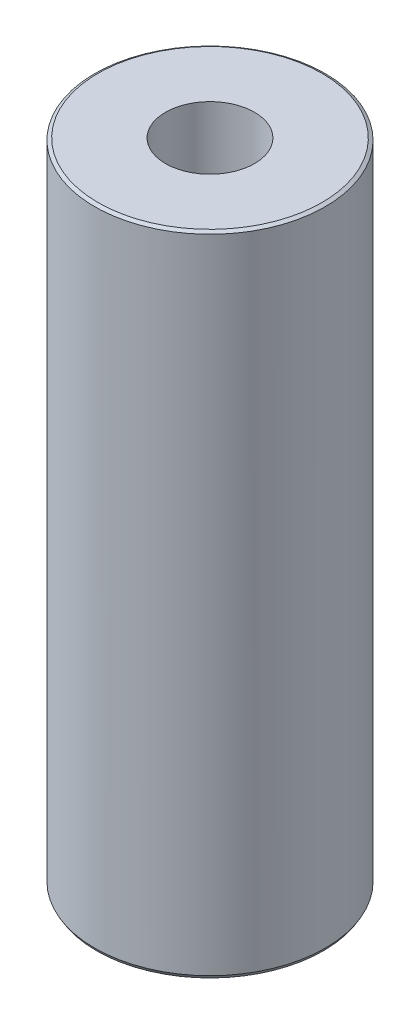
from build123d import *
from OCP.BRepFilletAPI import BRepFilletAPI_MakeChamfer

# Parameters (mm, degrees)
SKETCH1_R           = 22.5
BOSS_EXTRUDE1_DEPTH = 126.322816713
SKETCH2_R           = 8.684803949
CUT_EXTRUDE1_DEPTH  = 131.268776084
CHAMFER1_SIZE       = 0.374596634
CHAMFER1_SIZE2      = 0.648820402


with BuildPart() as part:
    # Sketch1 → Boss-Extrude1 (new body)
    with BuildSketch(Plane(origin=(0, 0, 0), x_dir=(1, 0, 0), z_dir=(0, 1, 0))):
        Circle(SKETCH1_R)
    extrude(amount=BOSS_EXTRUDE1_DEPTH)

    # Sketch2 → Cut-Extrude1 (cut, through all)
    with BuildSketch(Plane(origin=(0, 0, 0), x_dir=(1, 0, 0), z_dir=(0, 1, 0))):
        Circle(SKETCH2_R)
    extrude(amount=CUT_EXTRUDE1_DEPTH, mode=Mode.SUBTRACT)

    # Chamfer1: one chamfer whose edges measure the first distance from different faces: ONE call of the kernel's chamfer builder (chamfer() names one face for all edges)
    chamfer1_edges_1 = [part.edges().sort_by_distance(p)[0] for p in [
        (-22.5, 126.322816713, 0),
    ]]
    chamfer1_side_1 = [part.faces().sort_by_distance(p)[0] for p in [
        (-22.5, 63.161408357, 0),
    ]]
    chamfer1_edges_2 = [part.edges().sort_by_distance(p)[0] for p in [
        (-22.5, 0, 0),
    ]]
    chamfer1_side_2 = [part.faces().sort_by_distance(p)[0] for p in [
        (-21.863603897, 0, 0),
    ]]
    chamfer1 = BRepFilletAPI_MakeChamfer(part.part.solid().wrapped)
    for e in chamfer1_edges_1:
        chamfer1.Add(CHAMFER1_SIZE, CHAMFER1_SIZE2, e.wrapped, chamfer1_side_1[0].wrapped)  # the first distance lies on this face
    for e in chamfer1_edges_2:
        chamfer1.Add(CHAMFER1_SIZE, CHAMFER1_SIZE2, e.wrapped, chamfer1_side_2[0].wrapped)  # the first distance lies on this face
    add(Compound.cast(chamfer1.Shape()), mode=Mode.REPLACE)


solid = part.part
